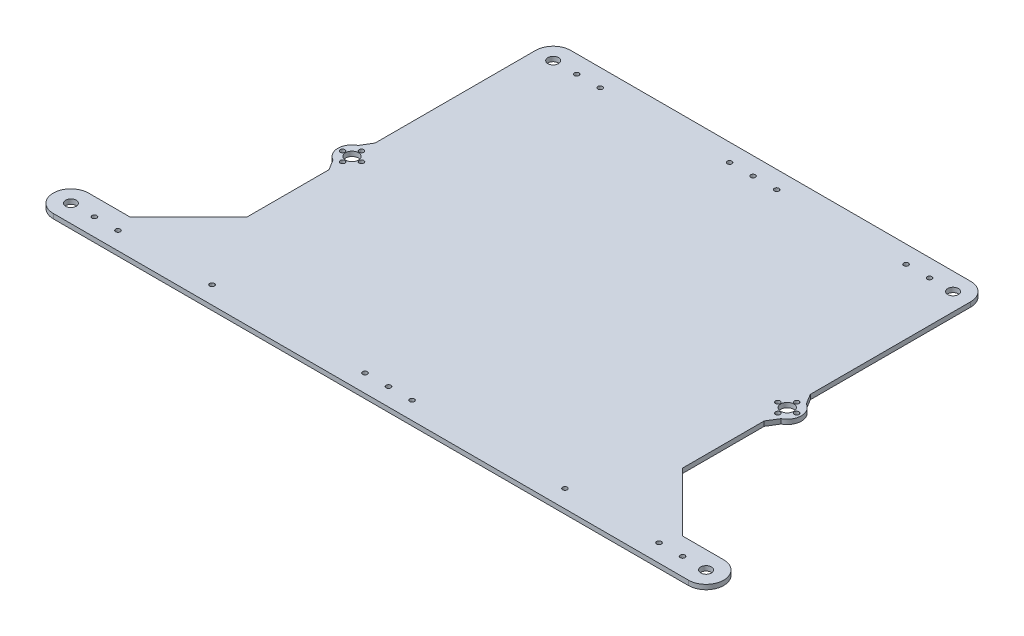
from build123d import *

# Parameters (mm, degrees)
SKETCH1_R           = 4.5
SKETCH1_R_2         = 2
SKETCH1_R_3         = 5.5
BOSS_EXTRUDE1_DEPTH = 4


with BuildPart() as part:
    # Sketch1 → Boss-Extrude1 (new body)
    with BuildSketch(Plane(origin=(0, 0, 0), x_dir=(1, 0, 0), z_dir=(0, 1, 0))):
        with BuildLine():
            Line((-270, 15), (-235, 15))
            Line((-235, 15), (-185, 65))
            Line((-185, 65), (-185, 142))
            ThreePointArc((-185, 142), (-197, 154), (-185, 166))
            Line((-185, 166), (-185, 310))
            ThreePointArc((-185, 310), (-180.606601718, 320.606601718), (-170, 325))
            Line((-170, 325), (170, 325))
            ThreePointArc((170, 325), (180.606601718, 320.606601718), (185, 310))
            Line((185, 310), (185, 166))
            ThreePointArc((185, 166), (197, 154), (185, 142))
            Line((185, 142), (185, 65))
            Line((185, 65), (235, 15))
            Line((235, 15), (270, 15))
            ThreePointArc((270, 15), (285, 0), (270, -15))
            Line((270, -15), (-270, -15))
            ThreePointArc((-270, -15), (-285, 0), (-270, 15))
        make_face()
        with Locations(Location((-170, 310, 0), (0, 0, 270))):
            Circle(SKETCH1_R, mode=Mode.SUBTRACT)
        with Locations(Location((170, 310, 0), (0, 0, 270))):
            Circle(SKETCH1_R, mode=Mode.SUBTRACT)
        with Locations(Location((-270, 0, 0), (0, 0, 270))):
            Circle(SKETCH1_R, mode=Mode.SUBTRACT)
        with Locations(Location((270, 0, 0), (0, 0, 270))):
            Circle(SKETCH1_R, mode=Mode.SUBTRACT)
        with Locations(Location((0, 310, 0), (0, 0, 270))):
            Circle(SKETCH1_R_2, mode=Mode.SUBTRACT)
        with Locations(Location((-150, 310, 0), (0, 0, 270))):
            Circle(SKETCH1_R_2, mode=Mode.SUBTRACT)
        with Locations(Location((150, 310, 0), (0, 0, 270))):
            Circle(SKETCH1_R_2, mode=Mode.SUBTRACT)
        with Locations(Location((0, 0, 0), (0, 0, 270))):
            Circle(SKETCH1_R_2, mode=Mode.SUBTRACT)
        with Locations(Location((-150, 0, 0), (0, 0, 270))):
            Circle(SKETCH1_R_2, mode=Mode.SUBTRACT)
        with Locations(Location((150, 0, 0), (0, 0, 270))):
            Circle(SKETCH1_R_2, mode=Mode.SUBTRACT)
        with Locations(Location((-185, 154, 0), (0, 0, 270))):
            Circle(SKETCH1_R_3, mode=Mode.SUBTRACT)
        with Locations(Location((-185, 162, 0), (0, 0, 270))):
            Circle(SKETCH1_R_2, mode=Mode.SUBTRACT)
        with Locations(Location((-177, 154, 0), (0, 0, 270))):
            Circle(SKETCH1_R_2, mode=Mode.SUBTRACT)
        with Locations(Location((-185, 146, 0), (0, 0, 270))):
            Circle(SKETCH1_R_2, mode=Mode.SUBTRACT)
        with Locations(Location((-193, 154, 0), (0, 0, 270))):
            Circle(SKETCH1_R_2, mode=Mode.SUBTRACT)
        with Locations(Location((185, 162, 0), (0, 0, 90))):
            Circle(SKETCH1_R_2, mode=Mode.SUBTRACT)
        with Locations(Location((177, 154, 0), (0, 0, 90))):
            Circle(SKETCH1_R_2, mode=Mode.SUBTRACT)
        with Locations(Location((185, 146, 0), (0, 0, 90))):
            Circle(SKETCH1_R_2, mode=Mode.SUBTRACT)
        with Locations(Location((193, 154, 0), (0, 0, 90))):
            Circle(SKETCH1_R_2, mode=Mode.SUBTRACT)
        with Locations(Location((185, 154, 0), (0, 0, 90))):
            Circle(SKETCH1_R_3, mode=Mode.SUBTRACT)
        with Locations(Location((-130, 310, 0), (0, 0, 270))):
            Circle(SKETCH1_R_2, mode=Mode.SUBTRACT)
        with Locations(Location((130, 310, 0), (0, 0, 270))):
            Circle(SKETCH1_R_2, mode=Mode.SUBTRACT)
        with Locations(Location((-20, 310, 0), (0, 0, 270))):
            Circle(SKETCH1_R_2, mode=Mode.SUBTRACT)
        with Locations(Location((20, 310, 0), (0, 0, 270))):
            Circle(SKETCH1_R_2, mode=Mode.SUBTRACT)
        with Locations(Location((-250, 0, 0), (0, 0, 270))):
            Circle(SKETCH1_R_2, mode=Mode.SUBTRACT)
        with Locations(Location((-230, 0, 0), (0, 0, 270))):
            Circle(SKETCH1_R_2, mode=Mode.SUBTRACT)
        with Locations(Location((-20, 0, 0), (0, 0, 270))):
            Circle(SKETCH1_R_2, mode=Mode.SUBTRACT)
        with Locations(Location((20, 0, 0), (0, 0, 90))):
            Circle(SKETCH1_R_2, mode=Mode.SUBTRACT)
        with Locations(Location((230, 0, 0), (0, 0, 90))):
            Circle(SKETCH1_R_2, mode=Mode.SUBTRACT)
        with Locations(Location((250, 0, 0), (0, 0, 90))):
            Circle(SKETCH1_R_2, mode=Mode.SUBTRACT)
    extrude(amount=BOSS_EXTRUDE1_DEPTH)

    # Chamfer1
    # the kernel refuses this chamfer: 10 mm, written as the material it adds along each edge
    with BuildSketch(Plane(origin=(-185, 0, -142), x_dir=(0.026309669702560337, 0, 0.99965384072695), z_dir=(0, 1, 0))) as chamfer1_piece_1:
        with BuildLine():
            Line((7.93978752, 0), (-1.800869825, -5.618003075))
            Line((-1.800869825, -5.618003075), (-1.976561079, -5.522438525))
            ThreePointArc((-1.976561079, -5.522438525), (-0.637668429, -2.883002495), (-0.199930768, 0.005261934))
            Line((-0.199930768, 0.005261934), (0.005261934, 0.199930768))
            ThreePointArc((0.005261934, 0.199930768), (3.972407738, 0.09552033), (7.945049453, 0.199930768))
            Line((7.945049453, 0.199930768), (7.93978752, 0))
        make_face()
    extrude(amount=4)
    with BuildSketch(Plane(origin=(-185, 0, -166), x_dir=(-0.9599725502617332, 0, 0.2800940962319344), z_dir=(0, 1, 0))) as chamfer1_piece_2:
        with BuildLine():
            Line((5.899583941, 0), (-2.423649516, -7.560829907))
            Line((-2.423649516, -7.560829907), (-2.615644026, -7.504811088))
            ThreePointArc((-2.615644026, -7.504811088), (-1.303553405, -3.753651008), (-0.19199451, 0.056018819))
            Line((-0.19199451, 0.056018819), (0.056018819, 0.19199451))
            ThreePointArc((0.056018819, 0.19199451), (2.9400505, -0.272813985), (5.862210991, 0.19647713))
            Line((5.862210991, 0.19647713), (5.899583941, 0))
        make_face()
    extrude(amount=4)

    # Chamfer2
    # the kernel refuses this chamfer: 10 mm, written as the material it adds along each edge
    with BuildSketch(Plane(origin=(185, 0, -166), x_dir=(0.9599725502617332, 0, 0.2800940962319344), z_dir=(0, 1, 0))) as chamfer2_piece_1:
        with BuildLine():
            Line((5.899583941, 0), (-2.423649516, 7.560829907))
            Line((-2.423649516, 7.560829907), (-2.615644026, 7.504811088))
            ThreePointArc((-2.615644026, 7.504811088), (-1.303553405, 3.753651008), (-0.19199451, -0.056018819))
            Line((-0.19199451, -0.056018819), (0.056018819, -0.19199451))
            ThreePointArc((0.056018819, -0.19199451), (2.9400505, 0.272813985), (5.862210991, -0.19647713))
            Line((5.862210991, -0.19647713), (5.899583941, 0))
        make_face()
    extrude(amount=4)
    with BuildSketch(Plane(origin=(185, 0, -142), x_dir=(-0.026309669702560337, 0, 0.99965384072695), z_dir=(0, 1, 0))) as chamfer2_piece_2:
        with BuildLine():
            Line((7.93978752, 0), (-1.800869825, 5.618003075))
            Line((-1.800869825, 5.618003075), (-1.976561079, 5.522438525))
            ThreePointArc((-1.976561079, 5.522438525), (-0.637668429, 2.883002495), (-0.199930768, -0.005261934))
            Line((-0.199930768, -0.005261934), (0.005261934, -0.199930768))
            ThreePointArc((0.005261934, -0.199930768), (3.972407738, -0.09552033), (7.945049453, -0.199930768))
            Line((7.945049453, -0.199930768), (7.93978752, 0))
        make_face()
    extrude(amount=4)


solid = part.part
